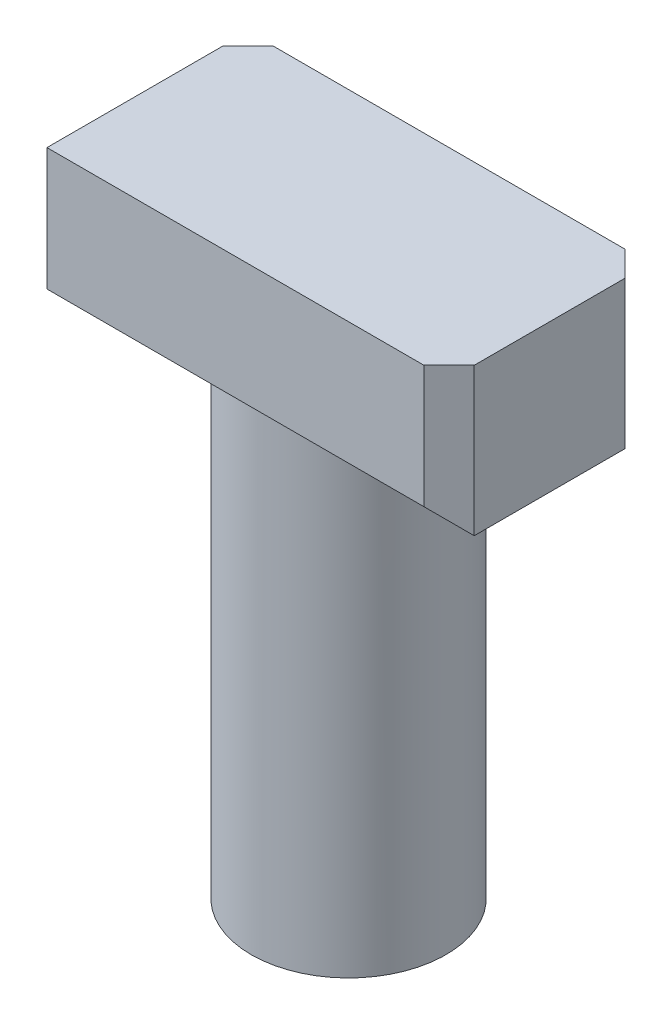
from build123d import *

# Parameters (mm, degrees)
SKETCH1_R           = 6.15
BOSS_EXTRUDE1_DEPTH = 28.575
SKETCH3_W           = 25.4
SKETCH3_H           = 12.7
BOSS_EXTRUDE2_DEPTH = 9.325


with BuildPart() as part:
    # Sketch1 → Boss-Extrude1 (new body)
    with BuildSketch(Plane(origin=(0, 0, 0), x_dir=(1, 0, 0), z_dir=(0, 1, 0))):
        with Locations(Location((0, 1.507106584, 0), (0, 0, 270))):
            Circle(SKETCH1_R)
    extrude(amount=BOSS_EXTRUDE1_DEPTH)

    # Sketch3 → Boss-Extrude2 (add)
    with BuildSketch(Plane(origin=(0, 28.575, 0), x_dir=(1, 0, 0), z_dir=(0, 1, 0))):
        with Locations((0, 1.507106584)):
            Rectangle(SKETCH3_W, SKETCH3_H)
    extrude(amount=BOSS_EXTRUDE2_DEPTH)

    # Chamfer1
    # the kernel refuses this chamfer: 1.5875 mm, written as the material it takes off along each edge
    with BuildSketch(Plane(origin=(-11.641666667, 29.633333333, -6.798773251), x_dir=(0.7071067811865478, -0.707106781186547, 0), z_dir=(-0.5773502691896255, -0.5773502691896262, -0.5773502691896257))) as chamfer1_piece_1:
        Polygon((-1.122532015, 0.648094161), (1.122532015, 0.648094161), (0, -1.296188322), align=None)
    extrude(amount=2.016395815, mode=Mode.SUBTRACT)
    with BuildSketch(Plane(origin=(-12.7, 28.575, 8.925440159), x_dir=(-0.027495876610586785, 0.9996219169112966, 0), z_dir=(0, 0, -1))) as chamfer1_piece_2:
        with BuildLine():
            Line((1.633018697, 0), (-0.089768608, 1.630549497))
            Line((-0.089768608, 1.630549497), (-0.121506604, 1.629676503))
            ThreePointArc((-0.121506604, 1.629676503), (-0.054180148, 0.815019055), (-0.031737996, -0.000872994))
            Line((-0.031737996, -0.000872994), (0.000872994, -0.031737996))
            ThreePointArc((0.000872994, -0.031737996), (0.816765043, -0.009295844), (1.633891691, -0.031737996))
            Line((1.633891691, -0.031737996), (1.633018697, 0))
        make_face()
    extrude(amount=20.865093487, mode=Mode.SUBTRACT)
    with BuildSketch(Plane(origin=(-12.7, 24.492453257, -7.857106584), x_dir=(-0.02749587661058674, 0, 0.9996219169112966), z_dir=(0, 1, 0))) as chamfer1_piece_3:
        with BuildLine():
            Line((1.633018697, 0), (-0.089768608, 1.630549497))
            Line((-0.089768608, 1.630549497), (-0.121506604, 1.629676503))
            ThreePointArc((-0.121506604, 1.629676503), (-0.054180148, 0.815019055), (-0.031737996, -0.000872994))
            Line((-0.031737996, -0.000872994), (0.000872994, -0.031737996))
            ThreePointArc((0.000872994, -0.031737996), (0.816765043, -0.009295844), (1.633891691, -0.031737996))
            Line((1.633891691, -0.031737996), (1.633018697, 0))
        make_face()
    extrude(amount=17.490093487, mode=Mode.SUBTRACT)
    with BuildSketch(Plane(origin=(16.782546743, 28.575, 4.842893416), x_dir=(0, 0.9996219169112966, 0.02749587661058624), z_dir=(-1, 0, 0))) as chamfer1_piece_4_section:
        with BuildLine():
            Line((1.633018697, 0), (-0.089768608, 1.630549497))
            Line((-0.089768608, 1.630549497), (-0.121506604, 1.629676503))
            ThreePointArc((-0.121506604, 1.629676503), (-0.054180148, 0.815019055), (-0.031737996, -0.000872994))
            Line((-0.031737996, -0.000872994), (0.000872994, -0.031737996))
            ThreePointArc((0.000872994, -0.031737996), (0.816765043, -0.009295844), (1.633891691, -0.031737996))
            Line((1.633891691, -0.031737996), (1.633018697, 0))
        make_face()
    chamfer1_piece_4 = extrude(amount=33.565093487, mode=Mode.PRIVATE)
    chamfer1_piece_4 = chamfer1_piece_4 - Plane(origin=(0, 29.903258734, -1.507106584), x_dir=(0, 0, 1), z_dir=(0, -1, 0)) * Cylinder(6.15, 74, mode=Mode.PRIVATE)
    add(chamfer1_piece_4, mode=Mode.SUBTRACT)
    with BuildSketch(Plane(origin=(12.7, 24.492453257, 4.842893416), x_dir=(-0.9996219169112968, 0, 0.027495876610586185), z_dir=(0, 1, 0)), Plane(origin=(12.7, 24.492453257, -7.857106584), x_dir=(0.027495876610586754, 0, 0.9996219169112966), z_dir=(0, 1, 0))) as chamfer1_piece_5:
        with BuildLine():
            Line((1.633018697, 0), (-0.089768608, -1.630549497))
            Line((-0.089768608, -1.630549497), (-0.121506604, -1.629676503))
            ThreePointArc((-0.121506604, -1.629676503), (-0.054180148, -0.815019055), (-0.031737996, 0.000872994))
            Line((-0.031737996, 0.000872994), (0.000872994, 0.031737996))
            ThreePointArc((0.000872994, 0.031737996), (0.816765043, 0.009295844), (1.633891691, 0.031737996))
            Line((1.633891691, 0.031737996), (1.633018697, 0))
        make_face()
    extrude(amount=17.490093487, mode=Mode.SUBTRACT)
    with BuildSketch(Plane(origin=(-16.782546743, 28.575, -7.857106584), x_dir=(0, -0.027495876610585654, 0.9996219169112968), z_dir=(1, 0, 0))) as chamfer1_piece_6_section:
        with BuildLine():
            Line((1.633018697, 0), (-0.089768608, -1.630549497))
            Line((-0.089768608, -1.630549497), (-0.121506604, -1.629676503))
            ThreePointArc((-0.121506604, -1.629676503), (-0.054180148, -0.815019055), (-0.031737996, 0.000872994))
            Line((-0.031737996, 0.000872994), (0.000872994, 0.031737996))
            ThreePointArc((0.000872994, 0.031737996), (0.816765043, 0.009295844), (1.633891691, 0.031737996))
            Line((1.633891691, 0.031737996), (1.633018697, 0))
        make_face()
    chamfer1_piece_6 = extrude(amount=33.565093487, mode=Mode.PRIVATE)
    chamfer1_piece_6 = chamfer1_piece_6 - Plane(origin=(0, 28.785057027, -1.507106584), x_dir=(0, 0, 1), z_dir=(0, -1, 0)) * Cylinder(6.15, 74, mode=Mode.PRIVATE)
    add(chamfer1_piece_6, mode=Mode.SUBTRACT)


solid = part.part
